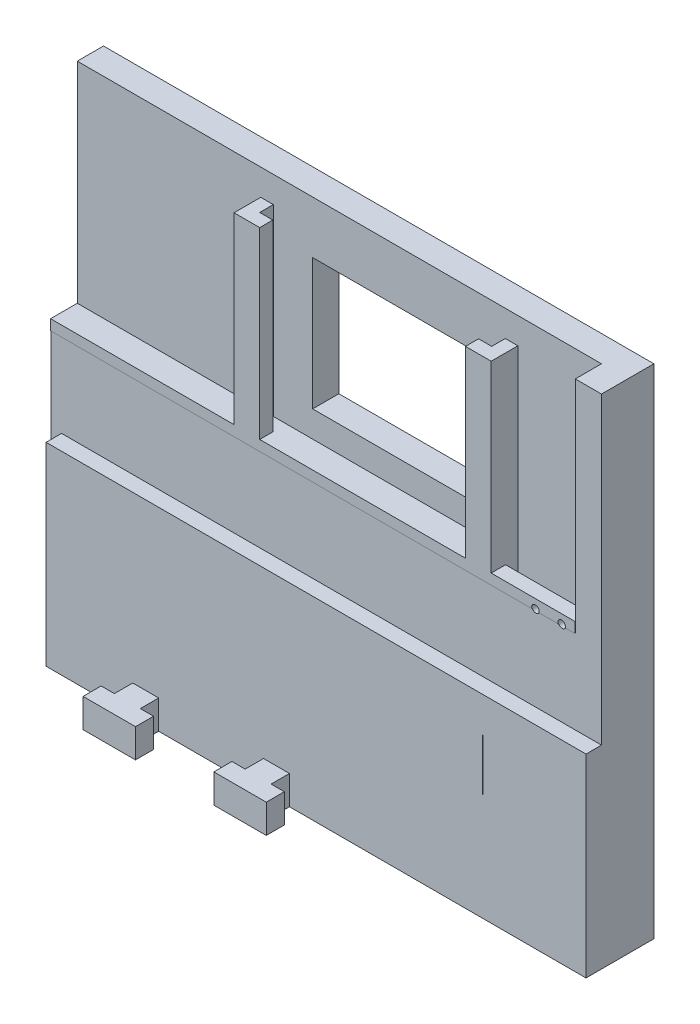
from build123d import *

# Parameters (mm, degrees)
SKETCH1_W           = 200
SKETCH1_H           = 80
BOSS_EXTRUDE1_DEPTH = 10
BOSS_EXTRUDE2_DEPTH = 70
SKETCH3_W           = 58.5
SKETCH3_H           = 50
CUT_EXTRUDE1_DEPTH  = 10
SKETCH5_W           = 200
SKETCH5_H           = 20.2
BOSS_EXTRUDE3_DEPTH = 4
BOSS_EXTRUDE5_DEPTH = 20
SKETCH7_W           = 206.000903411
SKETCH7_H           = 74
SKETCH7_W_2         = 0.268020534
SKETCH7_H_2         = 19.603817147
BOSS_EXTRUDE6_DEPTH = 5.9
BOSS_EXTRUDE7_DEPTH = 11
SKETCH21_W          = 31.9
SKETCH21_H          = 4.7
CUT_EXTRUDE7_DEPTH  = 5.5
SKETCH22_R          = 1.425
CUT_EXTRUDE8_DEPTH  = 5.5


with BuildPart() as part:
    # Sketch1 → Boss-Extrude1 (new body)
    with BuildSketch(Plane.XY):
        Rectangle(SKETCH1_W, SKETCH1_H)
    extrude(amount=BOSS_EXTRUDE1_DEPTH)

    # Sketch2 → Boss-Extrude2 (add)
    with BuildSketch(Plane.XZ.offset(40)):
        Polygon((-30, 10), (-25.2, 10), (-25.2, 15.2), (-20.2, 15.2), (-20.2, 20.2), (-30, 20.2), align=None)
        Polygon((63.3, 10), (68.1, 10), (68.1, 20.2), (58.3, 20.2), (58.3, 15.2), (63.3, 15.2), align=None)
    extrude(amount=-BOSS_EXTRUDE2_DEPTH)

    # Sketch3 → Cut-Extrude1 (cut)
    with BuildSketch(Plane.XY.offset(10)):
        with Locations((19.05, -5)):
            Rectangle(SKETCH3_W, SKETCH3_H)
    extrude(amount=-CUT_EXTRUDE1_DEPTH, mode=Mode.SUBTRACT)

    # Sketch5 → Boss-Extrude3 (add)
    with BuildSketch(Plane(origin=(0, -40, 0), x_dir=(-1, 0, 0), z_dir=(0, -1, 0))):
        with Locations((0, -10.1)):
            Rectangle(SKETCH5_W, SKETCH5_H)
    extrude(amount=BOSS_EXTRUDE3_DEPTH)

    # Sketch6 → Boss-Extrude5 (add)
    with BuildSketch(Plane(origin=(0, 0, 0), x_dir=(-1, 0, 0), z_dir=(0, 0, -1))):
        Polygon((100, -150), (100, -44), (-100, -44), (-100, 40), (-110, 40), (-110, -150), align=None)
    extrude(amount=-BOSS_EXTRUDE5_DEPTH)

    # Sketch7 → Boss-Extrude6 (add)
    with BuildSketch(Plane.XY.offset(20)):
        with Locations((6.999548294, -113)):
            Rectangle(SKETCH7_W, SKETCH7_H)
        with Locations((70.627340548, -99.185279167)):
            Rectangle(SKETCH7_W_2, SKETCH7_H_2, mode=Mode.SUBTRACT)
    extrude(amount=BOSS_EXTRUDE6_DEPTH)

    # Sketch8 → Boss-Extrude7 (add)
    with BuildSketch(Plane.XZ.offset(150)):
        Polygon((-68, 32.9), (-62.95, 32.9), (-62.95, 25.9), (-53.05, 25.9), (-53.05, 32.9), (-48, 32.9), (-48, 39.8), (-68, 39.8), align=None)
        Polygon((-13.05, 32.9), (-13.05, 25.9), (-3.15, 25.9), (-3.15, 32.9), (1.9, 32.9), (1.9, 39.8), (-18.1, 39.8), (-18.1, 32.9), align=None)
    extrude(amount=-BOSS_EXTRUDE7_DEPTH)

    # Sketch21 → Cut-Extrude7 (cut)
    with BuildSketch(Plane(origin=(0, -40, 0), x_dir=(1, 0, 0), z_dir=(0, 1, 0))):
        with Locations((84.05, -12.35)):
            Rectangle(SKETCH21_W, SKETCH21_H)
    extrude(amount=-CUT_EXTRUDE7_DEPTH, mode=Mode.SUBTRACT)

    # Sketch22 → Cut-Extrude8 (cut)
    with BuildSketch(Plane.XY.offset(20.2)):
        with Locations((95, -43.5)):
            Circle(SKETCH22_R)
        with Locations((85, -43.5)):
            Circle(SKETCH22_R)
    extrude(amount=-CUT_EXTRUDE8_DEPTH, mode=Mode.SUBTRACT)


solid = part.part
